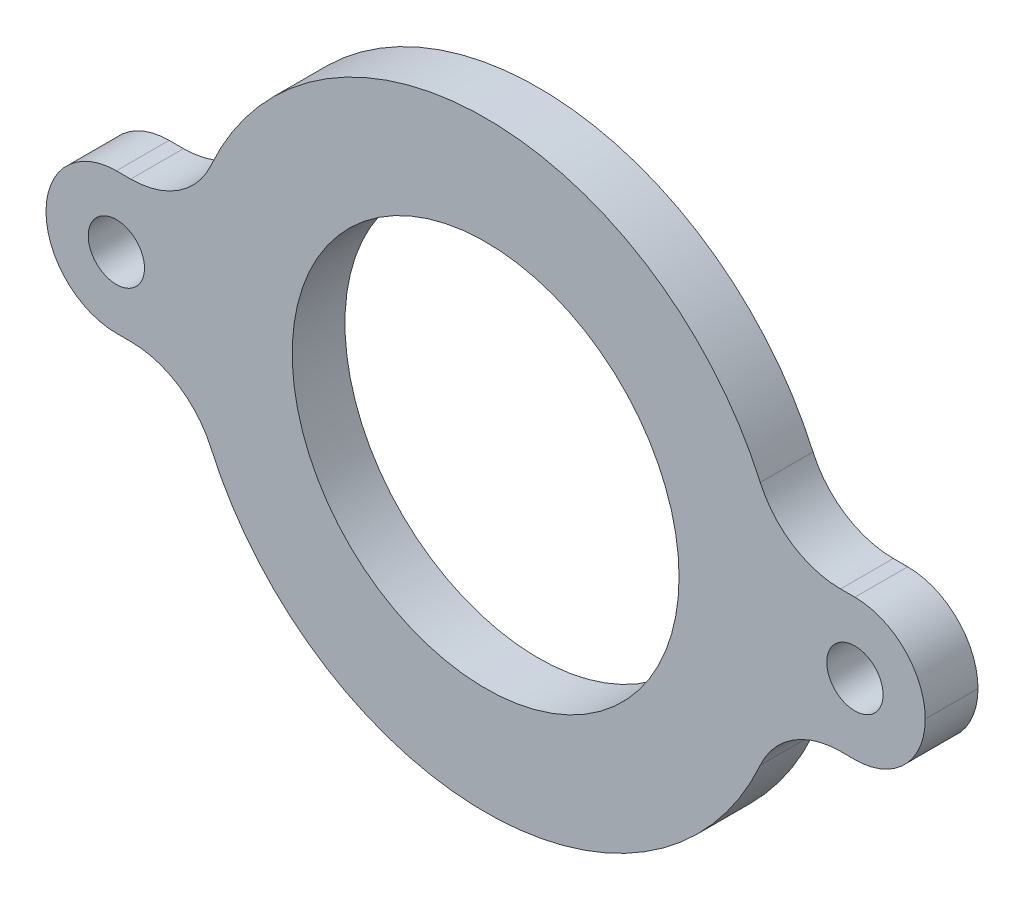
from build123d import *

# Parameters (mm, degrees)
ESBO_O1_R                = 11
ESBO_O1_R_2              = 1.6
RESSALTO_EXTRUS_O1_DEPTH = 3
FILETE2_R                = 5
FILETE3_R                = 4


with BuildPart() as part:
    # Esboço1 → Ressalto-extrusão1 (new body)
    with BuildSketch(Plane.XY):
        with BuildLine():
            Line((-25, 4), (-16.625582697, 4))
            ThreePointArc((-16.625582697, 4), (0, 17.1), (16.625582697, 4))
            Line((16.625582697, 4), (25, 4))
            Line((25, 4), (25, -4))
            Line((25, -4), (16.625582697, -4))
            ThreePointArc((16.625582697, -4), (0, -17.1), (-16.625582697, -4))
            Line((-16.625582697, -4), (-25, -4))
            Line((-25, -4), (-25, 4))
        make_face()
        Circle(ESBO_O1_R, mode=Mode.SUBTRACT)
        with Locations((-21, 0)):
            Circle(ESBO_O1_R_2, mode=Mode.SUBTRACT)
        with Locations((21, 0)):
            Circle(ESBO_O1_R_2, mode=Mode.SUBTRACT)
    extrude(amount=RESSALTO_EXTRUS_O1_DEPTH)

    # Filete2
    filete2_edges = [part.edges().sort_by_distance(p)[0] for p in [
        (-16.625582697, 4, 1.5),
        (16.625582697, 4, 1.5),
        (16.625582697, -4, 1.5),
        (-16.625582697, -4, 1.5),
    ]]
    fillet(filete2_edges, radius=FILETE2_R)

    # Filete3
    filete3_edges = [part.edges().sort_by_distance(p)[0] for p in [
        (25, -4, 1.5),
        (25, 4, 1.5),
        (-25, -4, 1.5),
        (-25, 4, 1.5),
    ]]
    fillet(filete3_edges, radius=FILETE3_R - 0.0001)  # a hair under: the kernel refuses the full size


solid = part.part
